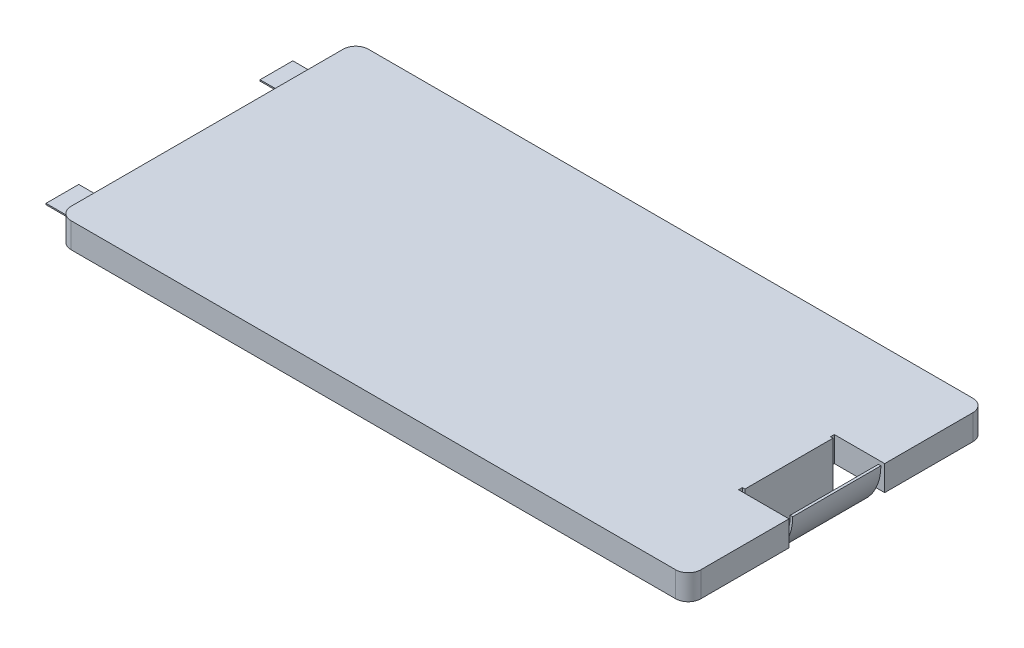
from build123d import *

# Parameters (mm, degrees)
SKETCH1_W             = 63.5
SKETCH1_H             = 29.972
BOSS_EXTRUDE1_DEPTH   = 2.54
FILLET1_R             = 1.27
SKETCH2_W             = 10.16
SKETCH2_H             = 9.652
CUT_EXTRUDE1_DEPTH    = 36.200771242
SKETCH3_W             = 4.773107024
SKETCH3_H             = 7.112
BOSS_EXTRUDE2_DEPTH   = 2.54
BOSS_EXTRUDE2_TAPER   = 31
SKETCH4_W             = 2.386553512
SKETCH4_H             = 7.112
CUT_EXTRUDE2_DEPTH    = 36.200771249
BOSS_EXTRUDE4_DEPTH   = 4.445
SKETCH11_W            = 3.302
SKETCH11_H            = 0.254
BOSS_EXTRUDE5_DEPTH   = 3.81
BOSS_EXTRUDE5_2_DEPTH = 3.81
SKETCH12_W            = 3.302
SKETCH12_H            = 0.127
CUT_EXTRUDE3_DEPTH    = 66.293811319


with BuildPart() as part:
    # Sketch1 → Boss-Extrude1 (new body)
    with BuildSketch(Plane(origin=(0, 0, 0), x_dir=(1, 0, 0), z_dir=(0, 1, 0))):
        Rectangle(SKETCH1_W, SKETCH1_H)
    extrude(amount=BOSS_EXTRUDE1_DEPTH)

    # Fillet1
    fillet1_edges = [part.edges().sort_by_distance(p)[0] for p in [
        (-31.75, 1.27, -14.986),
        (-31.75, 1.27, 14.986),
        (31.75, 1.27, -14.986),
        (31.75, 1.27, 14.986),
    ]]
    fillet(fillet1_edges, radius=FILLET1_R)

    # Sketch2 → Cut-Extrude1 (cut, through all)
    with BuildSketch(Plane(origin=(0, 2.54, 0), x_dir=(1, 0, 0), z_dir=(0, 1, 0))):
        with Locations((31.75, 0)):
            Rectangle(SKETCH2_W, SKETCH2_H)
    extrude(amount=-CUT_EXTRUDE1_DEPTH, mode=Mode.SUBTRACT)

    # Sketch3 → Boss-Extrude2 (add)
    with BuildSketch(Plane.XZ):
        with Locations((26.67, 0)):
            Rectangle(SKETCH3_W, SKETCH3_H)
    extrude(amount=BOSS_EXTRUDE2_DEPTH, taper=BOSS_EXTRUDE2_TAPER)

    # Sketch4 → Cut-Extrude2 (cut, through all)
    with BuildSketch(Plane(origin=(0, 0, 0), x_dir=(1, 0, 0), z_dir=(0, 1, 0))):
        with Locations((27.863276756, 0)):
            Rectangle(SKETCH4_W, SKETCH4_H)
    extrude(amount=-CUT_EXTRUDE2_DEPTH, mode=Mode.SUBTRACT)

    # Sketch10 → Boss-Extrude4 (add, symmetric)
    with BuildSketch(Plane.XY):
        with BuildLine():
            Line((26.67, 2.54), (26.67, -2.54))
            ThreePointArc((26.67, -2.54), (30.262102448, -1.052102448), (31.75, 2.54))
            Line((31.75, 2.54), (31.496, 2.54))
            ThreePointArc((31.496, 2.54), (30.171148383, -0.781480995), (26.924, -2.279311154))
            Line((26.924, -2.279311154), (26.924, 2.54))
            Line((26.924, 2.54), (26.67, 2.54))
        make_face()
    extrude(amount=BOSS_EXTRUDE4_DEPTH, both=True)


with BuildPart() as body_2:
    # Sketch11 → Boss-Extrude5 (new body)
    with BuildSketch(Plane.ZY.offset(31.75)):
        with Locations((10.795, 0.127)):
            Rectangle(SKETCH11_W, SKETCH11_H)
    extrude(amount=BOSS_EXTRUDE5_DEPTH)


with BuildPart() as body_3:
    # Sketch11 → Boss-Extrude5 2 (new body)
    with BuildSketch(Plane.ZY.offset(31.75)):
        with Locations((-10.795, 0.127)):
            Rectangle(SKETCH11_W, SKETCH11_H)
    extrude(amount=BOSS_EXTRUDE5_2_DEPTH)


with BuildPart() as cut_extrude3_tool:
    # Sketch12 → Cut-Extrude3 (new, through all)
    with BuildSketch(Plane.ZY.offset(31.75)):
        with Locations((-10.795, 0.0635)):
            Rectangle(SKETCH12_W, SKETCH12_H)
        with Locations((10.795, 0.0635)):
            Rectangle(SKETCH12_W, SKETCH12_H)
    extrude(amount=CUT_EXTRUDE3_DEPTH)


with BuildPart() as body_2_1:
    add(body_2.part)

    # Cut-Extrude3: cut by cut_extrude3_tool
    add(cut_extrude3_tool.part, mode=Mode.SUBTRACT)


with BuildPart() as body_3_1:
    add(body_3.part)

    # Cut-Extrude3: cut by cut_extrude3_tool
    add(cut_extrude3_tool.part, mode=Mode.SUBTRACT)


solid = Compound([part.part, body_2_1.part, body_3_1.part])
